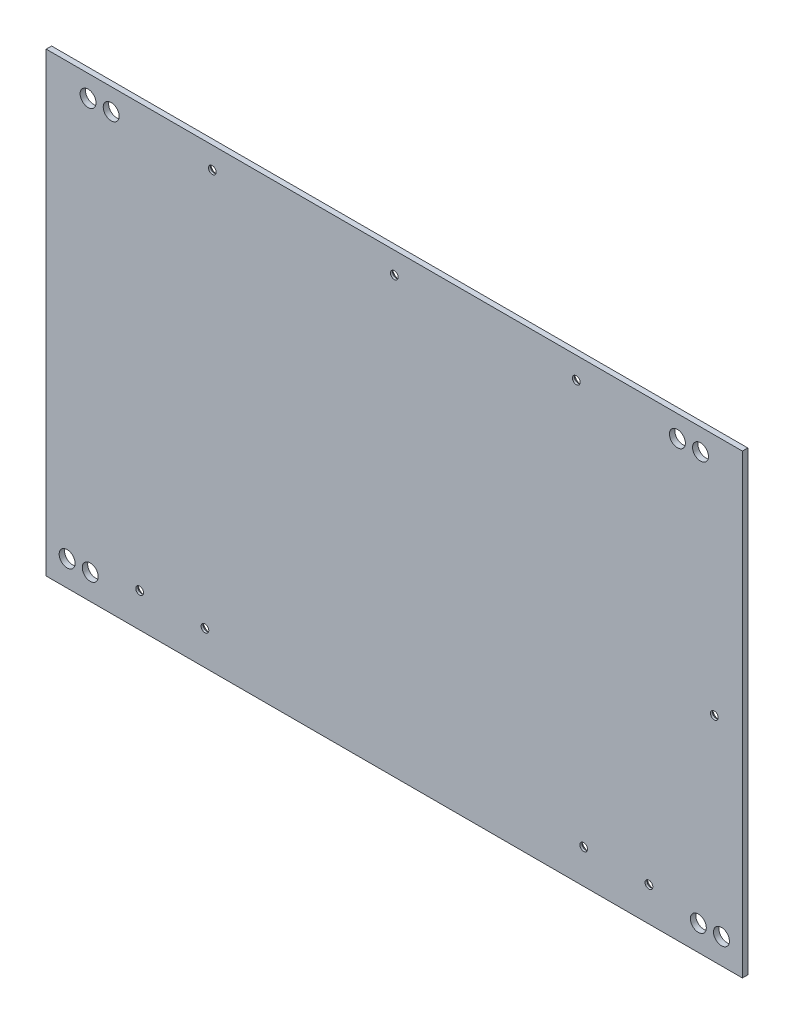
from build123d import *

# Parameters (mm, degrees)
SKETCH1_W                                      = 306.05
SKETCH1_H                                      = 197.425
BOSS_EXTRUDE1_DEPTH                            = 2.38125
SKETCH9_W                                      = 306.05
SKETCH9_H                                      = 2.38125
BOSS_EXTRUDE2_DEPTH                            = 3.175
SKETCH10_R                                     = 3.5
CUT_EXTRUDE1_DEPTH                             = 184.856965146
CSK_FOR_M3_FLAT_HEAD_MACHINE_SCREW1_AT_2_COUNT = 2
CSK_FOR_M3_FLAT_HEAD_MACHINE_SCREW1_AT_2_PITCH = 334.01604396
CSK_FOR_M3_FLAT_HEAD_MACHINE_SCREW1_AT_3_COUNT = 2
CSK_FOR_M3_FLAT_HEAD_MACHINE_SCREW1_AT_3_PITCH = 241.185121164
CSK_FOR_M3_FLAT_HEAD_MACHINE_SCREW1_AT_4_COUNT = 2
CSK_FOR_M3_FLAT_HEAD_MACHINE_SCREW1_AT_4_PITCH = 114.674594659
CSK_FOR_M3_FLAT_HEAD_MACHINE_SCREW1_AT_5_COUNT = 2
CSK_FOR_M3_FLAT_HEAD_MACHINE_SCREW1_AT_5_PITCH = 83.856540491
CSK_FOR_M3_FLAT_HEAD_MACHINE_SCREW1_AT_6_COUNT = 2
CSK_FOR_M3_FLAT_HEAD_MACHINE_SCREW1_AT_6_PITCH = 97.491369028
CSK_FOR_M3_FLAT_HEAD_MACHINE_SCREW1_AT_7_COUNT = 2
CSK_FOR_M3_FLAT_HEAD_MACHINE_SCREW1_AT_7_PITCH = 183.741799058
CSK_FOR_M3_FLAT_HEAD_MACHINE_SCREW1_AT_8_COUNT = 2
CSK_FOR_M3_FLAT_HEAD_MACHINE_SCREW1_AT_8_PITCH = 237.388930968
CSK_FOR_M3_FLAT_HEAD_MACHINE_SCREW1_AT_9_COUNT = 2
CSK_FOR_M3_FLAT_HEAD_MACHINE_SCREW1_AT_9_PITCH = 264.624553657
CSK_FOR_M3_FLAT_HEAD_MACHINE_SCREW1_AT_1_COUNT = 2
CSK_FOR_M3_FLAT_HEAD_MACHINE_SCREW1_AT_1_PITCH = 171.056314309


with BuildPart() as part:
    # Sketch1 → Boss-Extrude1 (new body)
    with BuildSketch(Plane.XY):
        Rectangle(SKETCH1_W, SKETCH1_H)
    extrude(amount=BOSS_EXTRUDE1_DEPTH)

    # Sketch9 → Boss-Extrude2 (add)
    with BuildSketch(Plane(origin=(0, 98.7125, 0), x_dir=(1, 0, 0), z_dir=(0, 1, 0))):
        with Locations((0, -1.190625)):
            Rectangle(SKETCH9_W, SKETCH9_H)
    extrude(amount=BOSS_EXTRUDE2_DEPTH)

    # Sketch10 → Cut-Extrude1 (cut, through all)
    with BuildSketch(Plane(origin=(0, 0, 0), x_dir=(-1, 0, 0), z_dir=(0, 0, -1))):
        with Locations((-124.450000066, 92.3625)):
            Circle(SKETCH10_R)
        with Locations((-134.610000066, 92.3625)):
            Circle(SKETCH10_R)
        with Locations((-133.657500066, -87.5375001)):
            Circle(SKETCH10_R)
        with Locations((-143.817500066, -87.5375001)):
            Circle(SKETCH10_R)
    cut_extrude1 = extrude(amount=-CUT_EXTRUDE1_DEPTH, mode=Mode.SUBTRACT)

    # Mirror1: Cut-Extrude1 across plane
    add(cut_extrude1.mirror(Plane(origin=(0, 0, 0), x_dir=(0, 0, 1), z_dir=(1, 0, 0))), mode=Mode.SUBTRACT)

    # Sketch12 → CSK for M3 Flat Head Machine Screw1 (revolve, cut)
    with BuildSketch(Plane(origin=(140.687500033, -4.9375, 0), x_dir=(0, 1, 0), z_dir=(1, 0, 0))):
        Polygon((0, 0), (0, 2.38125), (1.7, 2.38125), (1.7, 1.45), (3.15, 0), align=None)
    csk_for_m3_flat_head_machine_screw1 = revolve(axis=Axis((140.687500033, -4.9375, -6.35), (0, 0, 1)), mode=Mode.SUBTRACT)

    # CSK for M3 Flat Head Machine Screw1 at 2: CSK for M3 Flat Head Machine Screw1 ×2
    with Locations(*[Vector(-0.9927519414137833, 0.1201814578841687, 0) * (i * CSK_FOR_M3_FLAT_HEAD_MACHINE_SCREW1_AT_2_PITCH) for i in range(1, CSK_FOR_M3_FLAT_HEAD_MACHINE_SCREW1_AT_2_COUNT)]):
        add(csk_for_m3_flat_head_machine_screw1, mode=Mode.SUBTRACT)

    # CSK for M3 Flat Head Machine Screw1 at 3: CSK for M3 Flat Head Machine Screw1 ×2
    with Locations(*[Vector(-0.9150129119410818, 0.40342455426151513, 0) * (i * CSK_FOR_M3_FLAT_HEAD_MACHINE_SCREW1_AT_3_PITCH) for i in range(1, CSK_FOR_M3_FLAT_HEAD_MACHINE_SCREW1_AT_3_COUNT)]):
        add(csk_for_m3_flat_head_machine_screw1, mode=Mode.SUBTRACT)

    # CSK for M3 Flat Head Machine Screw1 at 4: CSK for M3 Flat Head Machine Screw1 ×2
    with Locations(*[Vector(-0.5292148641409085, 0.848487847627955, 0) * (i * CSK_FOR_M3_FLAT_HEAD_MACHINE_SCREW1_AT_4_PITCH) for i in range(1, CSK_FOR_M3_FLAT_HEAD_MACHINE_SCREW1_AT_4_COUNT)]):
        add(csk_for_m3_flat_head_machine_screw1, mode=Mode.SUBTRACT)

    # CSK for M3 Flat Head Machine Screw1 at 5: CSK for M3 Flat Head Machine Screw1 ×2
    with Locations(*[Vector(-0.3428176247746652, -0.9394019779326936, 0) * (i * CSK_FOR_M3_FLAT_HEAD_MACHINE_SCREW1_AT_5_PITCH) for i in range(1, CSK_FOR_M3_FLAT_HEAD_MACHINE_SCREW1_AT_5_COUNT)]):
        add(csk_for_m3_flat_head_machine_screw1, mode=Mode.SUBTRACT)

    # CSK for M3 Flat Head Machine Screw1 at 6: CSK for M3 Flat Head Machine Screw1 ×2
    with Locations(*[Vector(-0.5891547180576328, -0.8080202461513148, 0) * (i * CSK_FOR_M3_FLAT_HEAD_MACHINE_SCREW1_AT_6_PITCH) for i in range(1, CSK_FOR_M3_FLAT_HEAD_MACHINE_SCREW1_AT_6_COUNT)]):
        add(csk_for_m3_flat_head_machine_screw1, mode=Mode.SUBTRACT)

    # CSK for M3 Flat Head Machine Screw1 at 7: CSK for M3 Flat Head Machine Screw1 ×2
    with Locations(*[Vector(-0.7665176733023347, -0.642223213933579, 0) * (i * CSK_FOR_M3_FLAT_HEAD_MACHINE_SCREW1_AT_7_PITCH) for i in range(1, CSK_FOR_M3_FLAT_HEAD_MACHINE_SCREW1_AT_7_COUNT)]):
        add(csk_for_m3_flat_head_machine_screw1, mode=Mode.SUBTRACT)

    # CSK for M3 Flat Head Machine Screw1 at 8: CSK for M3 Flat Head Machine Screw1 ×2
    with Locations(*[Vector(-0.943335896578739, -0.3318393982425638, 0) * (i * CSK_FOR_M3_FLAT_HEAD_MACHINE_SCREW1_AT_8_PITCH) for i in range(1, CSK_FOR_M3_FLAT_HEAD_MACHINE_SCREW1_AT_8_COUNT)]):
        add(csk_for_m3_flat_head_machine_screw1, mode=Mode.SUBTRACT)

    # CSK for M3 Flat Head Machine Screw1 at 9: CSK for M3 Flat Head Machine Screw1 ×2
    with Locations(*[Vector(-0.9546638682701363, -0.2976859059806155, 0) * (i * CSK_FOR_M3_FLAT_HEAD_MACHINE_SCREW1_AT_9_PITCH) for i in range(1, CSK_FOR_M3_FLAT_HEAD_MACHINE_SCREW1_AT_9_COUNT)]):
        add(csk_for_m3_flat_head_machine_screw1, mode=Mode.SUBTRACT)

    # CSK for M3 Flat Head Machine Screw1 at 1: CSK for M3 Flat Head Machine Screw1 ×2
    with Locations(*[Vector(-0.8224630619486162, 0.5688185226679129, 0) * (i * CSK_FOR_M3_FLAT_HEAD_MACHINE_SCREW1_AT_1_PITCH) for i in range(1, CSK_FOR_M3_FLAT_HEAD_MACHINE_SCREW1_AT_1_COUNT)]):
        add(csk_for_m3_flat_head_machine_screw1, mode=Mode.SUBTRACT)


solid = part.part
